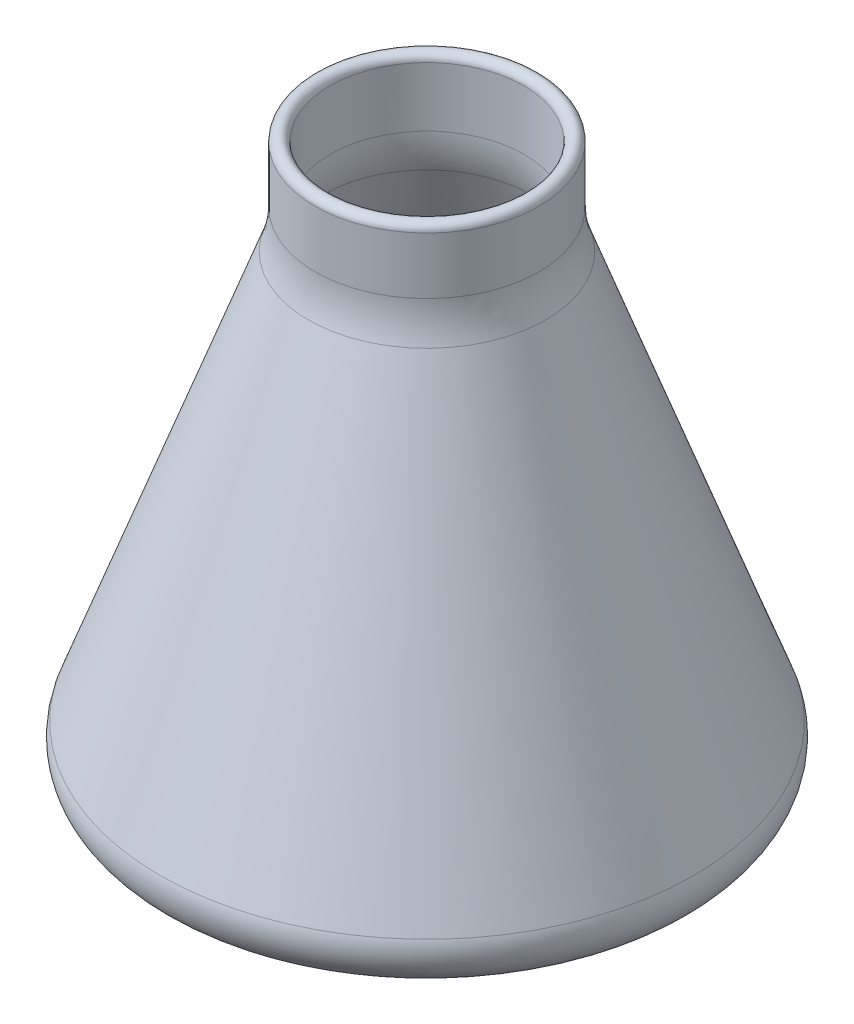
from build123d import *

# Parameters (mm, degrees)
SHELL1_T                  = -8
SHELL1_THICKNESS_2_FACE_R = 141.387225684
SHELL1_THICKNESS_2_DEPTH  = 4
FILLET1_R                 = 4
FILLET2_R                 = 60
FILLET3_R                 = 20


with BuildPart() as part:
    # Sketch1 → Revolve2 (revolve)
    with BuildSketch(Plane.XY, mode=Mode.PRIVATE) as revolve2_sk:
        Polygon((0, 0), (0, 300), (60, 300), (60, 255), (152.812409738, 0), align=None)
    revolve(revolve2_sk.sketch.rotate(Axis((0, 0, 0), (0, 1, 0)), 90), axis=Axis((0, 0, 0), (0, 1, 0)))

    # Shell1
    shell1_openings = [part.faces().sort_by_distance(p)[0] for p in [
        (0, 300, 0),
    ]]
    offset(amount=SHELL1_T, openings=shell1_openings, kind=Kind.INTERSECTION)

    # Shell1 thickness 2 face (on inner face of the shell) → Shell1 thickness 2 (add)
    with BuildSketch(Plane(origin=(0, 8, 0), x_dir=(0, 0, -1), z_dir=(0, -1, 0))):
        Circle(SHELL1_THICKNESS_2_FACE_R)
    extrude(amount=-SHELL1_THICKNESS_2_DEPTH)

    # Fillet1
    fillet1_edges = [part.edges().sort_by_distance(p)[0] for p in [
        (0, 300, 52),
        (0, 300, 60),
    ]]
    fillet(fillet1_edges, radius=FILLET1_R - 0.0001)  # a hair under: the kernel refuses the full size

    # Fillet2
    fillet2_edges = [part.edges().sort_by_distance(p)[0] for p in [
        (0, 253.589384154, 52),
        (0, 255, 60),
    ]]
    fillet(fillet2_edges, radius=FILLET2_R)

    # Fillet3
    fillet3_edges = [part.edges().sort_by_distance(p)[0] for p in [
        (0, 12, 139.931344747),
        (0, 0, 152.812409738),
    ]]
    fillet(fillet3_edges, radius=FILLET3_R)


solid = part.part
